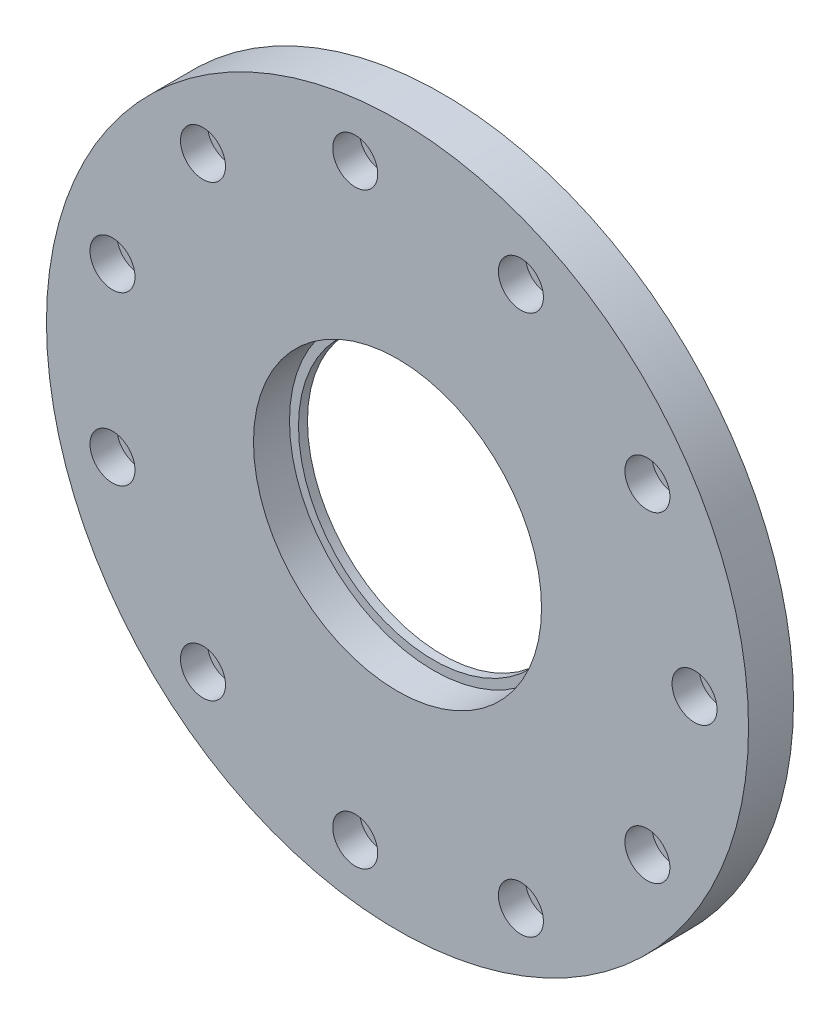
from build123d import *
from build123d.topology import SkipClean

# Parameters (mm, degrees)
SKETCH1_R           = 39
SKETCH1_R_2         = 2.5
SKETCH1_R_3         = 16
BOSS_EXTRUDE1_DEPTH = 3
BOSS_EXTRUDE2_START = 2
SKETCH2_R           = 39
SKETCH2_R_2         = 16
BOSS_EXTRUDE2_DEPTH = 2
SKETCH3_R           = 1.6
CUT_EXTRUDE1_DEPTH  = 56.380501984
SKETCH4_R           = 16
SKETCH4_R_2         = 15
BOSS_EXTRUDE3_DEPTH = 1


with BuildPart() as part:
    # Sketch1 → Boss-Extrude1 (new body)
    with BuildSketch(Plane.XY):
        Circle(SKETCH1_R)
        with Locations((33, 0)):
            Circle(SKETCH1_R_2, mode=Mode.SUBTRACT)
        with Locations((27.761366583, -17.841146976)):
            Circle(SKETCH1_R_2, mode=Mode.SUBTRACT)
        with Locations((13.708695429, -30.017855847)):
            Circle(SKETCH1_R_2, mode=Mode.SUBTRACT)
        with Locations((-4.696389663, -32.664107582)):
            Circle(SKETCH1_R_2, mode=Mode.SUBTRACT)
        with Locations((-21.61040422, -24.939735954)):
            Circle(SKETCH1_R_2, mode=Mode.SUBTRACT)
        with Locations((-31.663268129, -9.297174376)):
            Circle(SKETCH1_R_2, mode=Mode.SUBTRACT)
        with Locations((-31.663268129, 9.297174376)):
            Circle(SKETCH1_R_2, mode=Mode.SUBTRACT)
        with Locations((-21.61040422, 24.939735954)):
            Circle(SKETCH1_R_2, mode=Mode.SUBTRACT)
        with Locations((-4.696389663, 32.664107582)):
            Circle(SKETCH1_R_2, mode=Mode.SUBTRACT)
        with Locations((13.708695429, 30.017855847)):
            Circle(SKETCH1_R_2, mode=Mode.SUBTRACT)
        with Locations((27.761366583, 17.841146976)):
            Circle(SKETCH1_R_2, mode=Mode.SUBTRACT)
        Circle(SKETCH1_R_3, mode=Mode.SUBTRACT)
    extrude(amount=BOSS_EXTRUDE1_DEPTH)

    # Sketch2 → Boss-Extrude2 (add)
    with BuildSketch(Plane(origin=(0, 0, 0), x_dir=(-1, 0, 0), z_dir=(0, 0, -1)).offset(BOSS_EXTRUDE2_START)):
        Circle(SKETCH2_R)
        Circle(SKETCH2_R_2, mode=Mode.SUBTRACT)
    extrude(amount=-BOSS_EXTRUDE2_DEPTH)

    # Sketch3 → Cut-Extrude1 (cut, through all)
    with BuildSketch(Plane.XY.offset(3)):
        with Locations((33, 0)):
            Circle(SKETCH3_R)
        with Locations((27.761366583, -17.841146976)):
            Circle(SKETCH3_R)
        with Locations((13.708695429, -30.017855847)):
            Circle(SKETCH3_R)
        with Locations((-4.696389663, -32.664107582)):
            Circle(SKETCH3_R)
        with Locations((-21.61040422, -24.939735954)):
            Circle(SKETCH3_R)
        with Locations((-31.663268129, -9.297174376)):
            Circle(SKETCH3_R)
        with Locations((-31.663268129, 9.297174376)):
            Circle(SKETCH3_R)
        with Locations((-21.61040422, 24.939735954)):
            Circle(SKETCH3_R)
        with Locations((-4.696389663, 32.664107582)):
            Circle(SKETCH3_R)
        with Locations((13.708695429, 30.017855847)):
            Circle(SKETCH3_R)
        with Locations((27.761366583, 17.841146976)):
            Circle(SKETCH3_R)
    extrude(amount=-CUT_EXTRUDE1_DEPTH, mode=Mode.SUBTRACT)

    # Sketch4 → Boss-Extrude3 (add)
    with SkipClean():  # the faces are left unmerged after this step: merging them gives an invalid solid
        with BuildSketch(Plane(origin=(0, 0, -2), x_dir=(-1, 0, 0), z_dir=(0, 0, -1))):
            Circle(SKETCH4_R)
            Circle(SKETCH4_R_2, mode=Mode.SUBTRACT)
        extrude(amount=-BOSS_EXTRUDE3_DEPTH)


solid = part.part
